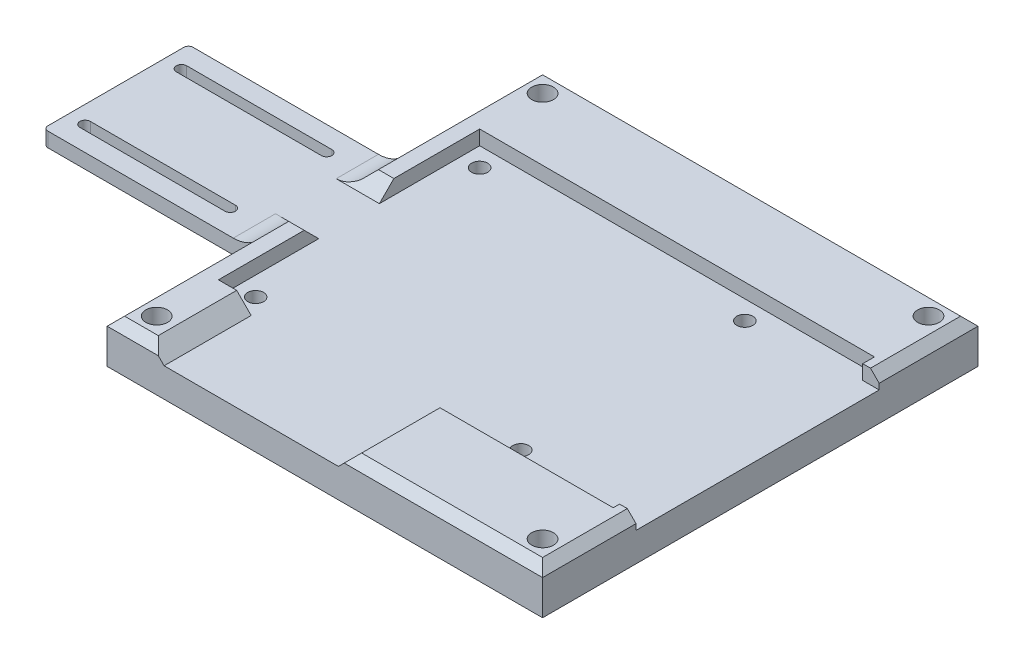
from build123d import *

# Parameters (mm, degrees)
SKETCH1_W                          = 95.25
SKETCH1_H                          = 95.25
BASE_EXTRUDE_DEPTH                 = 6.35
PI_SLOT_DEPTH                      = 3.175
CHAMFER1_SIZE                      = 3.81
CHAMFER2_SIZE                      = 1.905
CAMERA_START                       = 6.35
SKETCH3_W                          = 45.72
SKETCH3_H                          = 31.75
CAMERA_SLOT_DEPTH                  = 3.175
FILLET1_R                          = 1
CHAMFER3_SIZE                      = 1.905
CHAMFER3_SIZE2                     = 3.905828818
FILLET2_R                          = 7.46
F_3_16_0_1875_DIAMETER_HOLE1_D     = 4.7625
F_3_16_0_1875_DIAMETER_HOLE1_DEPTH = 9.525
F_3_16_0_1875_DIAMETER_HOLE1_TIP   = 1.430799349
F_3_5_3_5_DIAMETER_HOLE1_D         = 3.5
F_3_5_3_5_DIAMETER_HOLE1_DEPTH     = 4.064
F_3_5_3_5_DIAMETER_HOLE1_TIP       = 1.051506083


with BuildPart() as part:
    # Sketch1 → Base Extrude (new body)
    with BuildSketch(Plane(origin=(0, 0, 0), x_dir=(1, 0, 0), z_dir=(0, 1, 0))):
        Rectangle(SKETCH1_W, SKETCH1_H)
    extrude(amount=BASE_EXTRUDE_DEPTH)

    # Sketch2 → Pi Slot (add)
    with BuildSketch(Plane(origin=(0, 6.35, 0), x_dir=(1, 0, 0), z_dir=(0, 1, 0))):
        Polygon((-34.534633186, -28.575), (-42.33681664, -28.575), (-42.33681664, -6), (-47.625, -6), (-47.625, -47.625), (-34.534633186, -47.625), align=None)
        Polygon((2.325611102, -28.575), (2.325611102, -47.625), (47.625, -47.625), (47.625, -27.183287233), (44.02318336, -27.183287233), (44.02318336, -28.575), align=None)
        Polygon((-47.625, 47.625), (-47.625, 6), (-42.33681664, 6), (-42.33681664, 28.575), (44.02318336, 28.575), (44.02318336, 26.009127411), (47.625, 26.009127411), (47.625, 47.625), align=None)
    extrude(amount=PI_SLOT_DEPTH)

    # Chamfer1
    # the kernel refuses this chamfer: 3.81 mm, written as the material it takes off along each edge
    with BuildSketch(Plane(origin=(2.325611102, 9.525, 18.776887816), x_dir=(-0.027495876610586382, -0.9996219169112968, 0), z_dir=(0, 0, 1))) as chamfer1_piece_1_section:
        Polygon((CHAMFER1_SIZE * 0.999621916911, CHAMFER1_SIZE * 0.0274958766106), (-CHAMFER1_SIZE * 0.0274958766106, CHAMFER1_SIZE * 0.999621916911), (0, 0), align=None)
    chamfer1_piece_1 = extrude(amount=38.646224368, mode=Mode.PRIVATE)
    chamfer1_piece_1 = split(chamfer1_piece_1, bisect_by=Plane(origin=(3.62873216, 6.35, 38.1), z_dir=(0, 1, 0)), keep=Keep.TOP, mode=Mode.PRIVATE)
    add(chamfer1_piece_1, mode=Mode.SUBTRACT)
    with BuildSketch(Plane(origin=(-34.534633186, 9.525, 57.423112184), x_dir=(-0.9996219169112968, 0.02749587661058636, 0), z_dir=(0, 0, -1))) as chamfer1_piece_2_section:
        Polygon((CHAMFER1_SIZE * 0.999621916911, -CHAMFER1_SIZE * 0.0274958766106), (-CHAMFER1_SIZE * 0.0274958766106, -CHAMFER1_SIZE * 0.999621916911), (0, 0), align=None)
    chamfer1_piece_2 = extrude(amount=38.646224368, mode=Mode.PRIVATE)
    chamfer1_piece_2 = split(chamfer1_piece_2, bisect_by=Plane(origin=(-35.837754245, 6.35, 38.1), z_dir=(0, 1, 0)), keep=Keep.TOP, mode=Mode.PRIVATE)
    add(chamfer1_piece_2, mode=Mode.SUBTRACT)
    with BuildSketch(Plane(origin=(-32.538704456, 9.525, 6), x_dir=(0, 0.027495876610586386, 0.9996219169112968), z_dir=(-1, 0, 0))) as chamfer1_piece_3_section:
        Polygon((CHAMFER1_SIZE * 0.999621916911, -CHAMFER1_SIZE * 0.0274958766106), (-CHAMFER1_SIZE * 0.0274958766106, -CHAMFER1_SIZE * 0.999621916911), (0, 0), align=None)
    chamfer1_piece_3 = extrude(amount=24.884407728, mode=Mode.PRIVATE)
    chamfer1_piece_3 = split(chamfer1_piece_3, bisect_by=Plane(origin=(-44.98090832, 6.35, 7.303121058), z_dir=(0, 1, 0)), keep=Keep.TOP, mode=Mode.PRIVATE)
    add(chamfer1_piece_3, mode=Mode.SUBTRACT)
    with BuildSketch(Plane(origin=(-57.423112184, 9.525, -6), x_dir=(0, -0.9996219169112968, 0.027495876610586382), z_dir=(1, 0, 0))) as chamfer1_piece_4_section:
        Polygon((CHAMFER1_SIZE * 0.999621916911, CHAMFER1_SIZE * 0.0274958766106), (-CHAMFER1_SIZE * 0.0274958766106, CHAMFER1_SIZE * 0.999621916911), (0, 0), align=None)
    chamfer1_piece_4 = extrude(amount=24.884407728, mode=Mode.PRIVATE)
    chamfer1_piece_4 = split(chamfer1_piece_4, bisect_by=Plane(origin=(-44.98090832, 6.35, -7.303121058), z_dir=(0, 1, 0)), keep=Keep.TOP, mode=Mode.PRIVATE)
    add(chamfer1_piece_4, mode=Mode.SUBTRACT)

    # Chamfer2
    chamfer2_edges = [part.edges().sort_by_distance(p)[0] for p in [
        (-42.984816593, 9.525, 47.625),
        (47.625, 9.525, 37.404143616),
        (47.625, 9.525, -36.817063706),
        (0, 9.525, -47.625),
        (-47.625, 9.525, -28.7175),
        (26.880305551, 9.525, 47.625),
        (-47.625, 9.525, 28.7175),
    ]]
    chamfer(chamfer2_edges, length=CHAMFER2_SIZE)

    # Sketch3 → Camera Slot (add)
    with BuildSketch(Plane(origin=(0, 0, 0), x_dir=(1, 0, 0), z_dir=(0, 1, 0)).offset(CAMERA_START)):
        with Locations((-70.485, 0)):
            Rectangle(SKETCH3_W, SKETCH3_H)
        with BuildLine():
            Line((-89.535, 11.684), (-57.785, 11.684))
            ThreePointArc((-57.785, 11.684), (-56.642, 10.541), (-57.785, 9.398))
            Line((-57.785, 9.398), (-89.535, 9.398))
            ThreePointArc((-89.535, 9.398), (-90.678, 10.541), (-89.535, 11.684))
        make_face(mode=Mode.SUBTRACT)
        with BuildLine():
            Line((-89.535, -11.684), (-57.785, -11.684))
            ThreePointArc((-57.785, -11.684), (-56.642, -10.541), (-57.785, -9.398))
            Line((-57.785, -9.398), (-89.535, -9.398))
            ThreePointArc((-89.535, -9.398), (-90.678, -10.541), (-89.535, -11.684))
        make_face(mode=Mode.SUBTRACT)
    extrude(amount=-CAMERA_SLOT_DEPTH)

    # Fillet1
    fillet1_edges = [part.edges().sort_by_distance(p)[0] for p in [
        (-93.345, 4.7625, -15.875),
        (-93.345, 4.7625, 15.875),
    ]]
    fillet(fillet1_edges, radius=FILLET1_R)

    # Chamfer3
    chamfer3_edges = [part.edges().sort_by_distance(p)[0] for p in [
        (-47.625, 3.175, 0),
    ]]
    chamfer3_side = [part.faces().sort_by_distance(p)[0] for p in [
        (-47.625, 3.81, 46.669456861),
    ]]
    chamfer(chamfer3_edges, length=CHAMFER3_SIZE, length2=CHAMFER3_SIZE2, reference=chamfer3_side[0])

    # Fillet2
    # the kernel refuses this fillet: 7.46 mm, written as the material it adds along each edge
    with BuildSketch(Plane(origin=(-47.625, 6.35, -15.875), x_dir=(-1, 0, 0), z_dir=(0, 0, 1))) as fillet2_piece_1_section:
        with BuildLine():
            CenterArc((4.163592199, -7.46), FILLET2_R, 90, 33.926040017)
            Line((0, -1.27), (0, 0))
            Line((0, 0), (4.163592199, 0))
        make_face()
    fillet2_piece_1 = extrude(amount=19.648980498, mode=Mode.PRIVATE)
    fillet2_piece_1 = split(fillet2_piece_1, bisect_by=Plane(origin=(-49.607751226, 8.8151447, -9.1001447), z_dir=(0, -0.7071067811868302, -0.7071067811862648)), keep=Keep.TOP, mode=Mode.PRIVATE)
    add(fillet2_piece_1)
    with BuildSketch(Plane(origin=(-47.625, 6.35, -3.773980498), x_dir=(-1, 0, 0), z_dir=(0, 0, 1))) as fillet2_piece_2_section:
        with BuildLine():
            CenterArc((4.163592199, -7.46), FILLET2_R, 90, 33.926040017)
            Line((0, -1.27), (0, 0))
            Line((0, 0), (4.163592199, 0))
        make_face()
    fillet2_piece_2 = extrude(amount=19.648980498, mode=Mode.PRIVATE)
    fillet2_piece_2 = split(fillet2_piece_2, bisect_by=Plane(origin=(-49.607751226, 8.8151447, 9.1001447), z_dir=(0, -0.7071067811862648, 0.7071067811868302)), keep=Keep.TOP, mode=Mode.PRIVATE)
    add(fillet2_piece_2)

    # 3/16 (0.1875) Diameter Hole1
    with Locations(Plane(origin=(0, 9.525, 0), x_dir=(1, 0, 0), z_dir=(0, 1, 0))):
        with Locations((-42.207203769, 42.207203769), (42.207203769, 42.207203769), (42.207203769, -42.207203769), (-42.207203769, -42.207203769)):
            Hole(F_3_16_0_1875_DIAMETER_HOLE1_D / 2, depth=F_3_16_0_1875_DIAMETER_HOLE1_DEPTH)
            with Locations((0, 0, -(F_3_16_0_1875_DIAMETER_HOLE1_DEPTH + F_3_16_0_1875_DIAMETER_HOLE1_TIP / 2))):  # 118° drill point
                Cone(0, F_3_16_0_1875_DIAMETER_HOLE1_D / 2, F_3_16_0_1875_DIAMETER_HOLE1_TIP, mode=Mode.SUBTRACT)

    # Ø3.5 (3.5) Diameter Hole1
    with Locations(Plane(origin=(0, 6.35, 0), x_dir=(1, 0, 0), z_dir=(0, 1, 0))):
        with Locations((-38.178407454, 24.41003259), (19.821592546, 24.41003259), (19.821592546, -24.589967454), (-38.178407454, -24.589967454)):
            Hole(F_3_5_3_5_DIAMETER_HOLE1_D / 2, depth=F_3_5_3_5_DIAMETER_HOLE1_DEPTH)
            with Locations((0, 0, -(F_3_5_3_5_DIAMETER_HOLE1_DEPTH + F_3_5_3_5_DIAMETER_HOLE1_TIP / 2))):  # 118° drill point
                Cone(0, F_3_5_3_5_DIAMETER_HOLE1_D / 2, F_3_5_3_5_DIAMETER_HOLE1_TIP, mode=Mode.SUBTRACT)


solid = part.part
